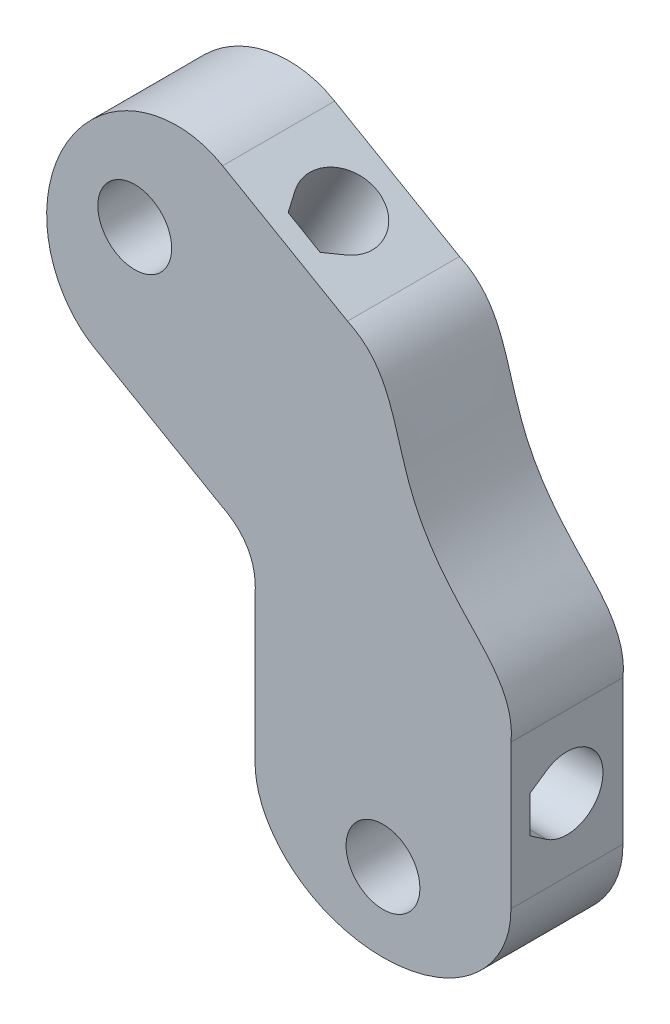
from build123d import *

# Parameters (mm, degrees)
MODEL_R               = 4.350000706
MODEL_R_2             = 4.349999799
MAIN_BODY_DEPTH       = 13.2
SIDE_UP_GRAPHIC_DEPTH = 1
HOLE_1_REACH          = 105.139
HOLE_2_REACH          = 92.65


with BuildPart() as part:
    # Model → Main body (new body)
    with BuildSketch(Plane.XY):
        with BuildLine():
            Line((-32.385302498, 85.015046672), (-17.6641047, 76.515992185))
            add(Edge.make_bspline(
                [(-17.6641047, 76.515992185), (-13.888722491, 74.796310279), (-12.180872378, 69.346040841), (-10.138677868, 62.322648787), (-7.341971914, 57.370319977), (-2.311172929, 51.709559883), (2.051619897, 47.586440686), (1.587639106, 43.172249148)],
                knots=[0, 0, 0, 0, 0.279425678, 0.419812348, 0.560237748, 0.707310623, 1, 1, 1, 1], degree=3))
            Line((1.587639106, 43.172249148), (1.587638631, 26.172213575))
            add(Edge.make_bspline(
                [(1.587638631, 26.172213575), (1.626935513, 22.433749487), (-1.504300665, 17.452795295), (-8.065829548, 14.211603151), (-13.487361838, 13.402379484), (-18.908893689, 14.211603727), (-25.470424367, 17.452793212), (-28.601657646, 22.43375075), (-28.56236242, 26.172213575)],
                knots=[0, 0, 0, 0, 0.249525848, 0.374711548, 0.499999996, 0.625288445, 0.750474147, 1, 1, 1, 1], degree=3))
            Line((-28.56236242, 26.172213575), (-28.562361946, 43.172249989))
            add(Edge.make_bspline(
                [(-32.754150677, 50.378549254), (-28.185743263, 48.160999644), (-28.562361946, 43.172249989)],
                knots=[0, 0, 0, 1, 1, 1], degree=2))
            Line((-32.754150677, 50.378549254), (-47.475348475, 58.877603741))
            add(Edge.make_bspline(
                [(-32.385302498, 85.015046672), (-35.600203539, 86.916558977), (-41.474057064, 86.69833839), (-47.559366694, 82.644576325), (-50.972165293, 78.360658434), (-52.984983955, 73.268398373), (-53.477328703, 65.955540856), (-50.700835269, 60.755344942), (-47.475348475, 58.877603741)],
                knots=[0, 0, 0, 0, 0.249289615, 0.374356151, 0.499525411, 0.624694605, 0.749762433, 1, 1, 1, 1], degree=3))
        make_face()
        with Locations((-13.487362418, 22.922213336)):
            Circle(MODEL_R, mode=Mode.SUBTRACT)
        with Locations((-42.737362401, 73.584699743)):
            Circle(MODEL_R_2, mode=Mode.SUBTRACT)
    extrude(amount=MAIN_BODY_DEPTH)

    # Model<4> → Side up graphic (cut)
    with BuildSketch(Plane.XY):
        Polygon((-23.949281442, 53.735095044), (-15.80864309, 58.435095807), (-17.1586416, 60.773364149), (-25.299281823, 56.073363324), (-26.59928106, 58.325030347), (-29.325818765, 52.247530958), (-22.649282205, 51.483428022), align=None)
        Polygon((-25.075818765, 44.886315366), (-18.399280297, 44.122214338), (-19.649280297, 46.287276288), (-11.508643853, 50.987277051), (-12.9086416, 53.412150465), (-21.049281823, 48.71214964), (-22.34928106, 50.963812848), align=None)
        Polygon((-10.0256307, 49.418623945), (-7.68736242, 50.768622419), (-15.537360894, 64.365221998), (-17.875629174, 63.015223523), align=None)
    extrude(amount=SIDE_UP_GRAPHIC_DEPTH, mode=Mode.SUBTRACT)

    # Schizzo5 → Hole 1 (cut, up to next)
    with BuildSketch(Plane(origin=(1.587637901, -4.4e-08, 0), x_dir=(0, 0, -1), z_dir=(0.9999999999999997, -2.789602577989315e-08, 0)), mode=Mode.PRIVATE) as hole_1_sk1:
        with BuildLine():
            Line((-10.95, 32.497231406), (-10.95, 36.847231406))
            Line((-10.95, 36.847231406), (-8.99780105, 38.181227006))
            ThreePointArc((-8.99780105, 38.181227006), (-2.35, 34.672231406), (-8.99780105, 31.163235806))
            Line((-8.99780105, 31.163235806), (-10.95, 32.497231406))
        make_face()
    hole_1_tool1 = extrude(hole_1_sk1.sketch, amount=-HOLE_1_REACH, mode=Mode.PRIVATE) & part.part
    add(hole_1_tool1.solids().sort_by_distance((1.587639, 34.672231, 6.73262))[0], mode=Mode.SUBTRACT)

    # Schizzo4 → Hole 2 (cut, up to next)
    with BuildSketch(Plane(origin=(28.716097743, 49.739103981, 0), x_dir=(0.8660313397108585, -0.499989718532907, 0), z_dir=(0.49998971853290697, 0.8660313397108584, 0)), mode=Mode.PRIVATE) as hole_2_sk1:
        with BuildLine():
            Line((-64.22910691, -10.95), (-59.87910691, -10.95))
            Line((-59.87910691, -10.95), (-58.545111309, -8.99780105))
            ThreePointArc((-58.545111309, -8.99780105), (-62.05410691, -2.35), (-65.56310251, -8.99780105))
            Line((-65.56310251, -8.99780105), (-64.22910691, -10.95))
        make_face()
    hole_2_tool1 = extrude(hole_2_sk1.sketch, amount=-HOLE_2_REACH, mode=Mode.PRIVATE) & part.part
    add(hole_2_tool1.solids().sort_by_distance((-25.024704, 80.765519, 6.73262))[0], mode=Mode.SUBTRACT)


solid = part.part
